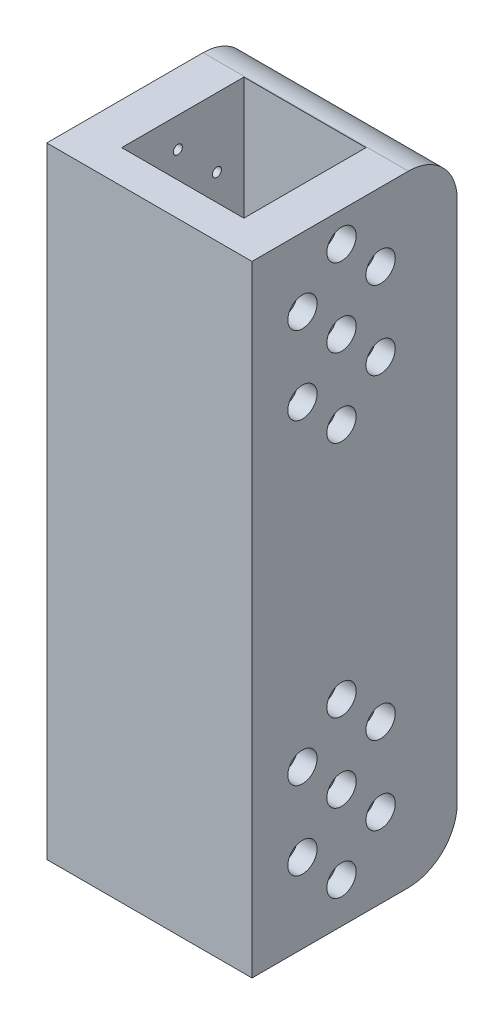
from build123d import *

# Parameters (mm, degrees)
SKETCH1_W                                           = 25
SKETCH1_H                                           = 25
BOSS_EXTRUDE1_DEPTH                                 = 127
BOSS_EXTRUDE2_DEPTH                                 = 38.819689331
FILLET1_R                                           = 10
FILLET2_R                                           = 10
CBORE_FOR_00_BINDING_HEAD_MACHINE_SCREW_D           = 1.3208
CBORE_FOR_00_BINDING_HEAD_MACHINE_SCREW_CBORE_D     = 5.999999938
CBORE_FOR_00_BINDING_HEAD_MACHINE_SCREW_CBORE_DEPTH = 3.000000096
CBORE_FOR_M5_HEX_HEAD_BOLT1_D                       = 1.85
CBORE_FOR_M5_HEX_HEAD_BOLT1_CBORE_D                 = 6
CBORE_FOR_M5_HEX_HEAD_BOLT1_CBORE_DEPTH             = 4


with BuildPart() as part:
    # Sketch1 → Boss-Extrude1 (new body)
    with BuildSketch(Plane(origin=(0, 0, 0), x_dir=(1, 0, 0), z_dir=(0, 1, 0))):
        Polygon((-34.725964288, 28.482386179), (-36.315964288, 28.482386179), (-36.315964288, -13.517613821), (5.684035712, -13.517613821), (5.684035712, 28.482386179), (4.093725043, 28.482386179), (4.093725043, 25.142386179), (-34.725964288, 25.142386179), align=None)
        with Locations((-15.315964288, 5.812386179)):
            Rectangle(SKETCH1_W, SKETCH1_H, mode=Mode.SUBTRACT)
    extrude(amount=BOSS_EXTRUDE1_DEPTH)

    # Sketch3 → Boss-Extrude2 (add)
    with BuildSketch(Plane(origin=(-34.725964288, 0, 0), x_dir=(0, 0, -1), z_dir=(1, 0, 0))):
        Polygon((28.482386179, 0.16286132), (25.142386179, 1.14), (25.142386179, 0), (28.482386179, 0), align=None)
        Polygon((28.482386179, 2.33286132), (25.142386179, 3.31), (25.142386179, 1.14), (28.482386179, 2.128184945), align=None)
        Polygon((28.482386179, 4.50286132), (25.142386179, 5.48), (25.142386179, 3.31), (28.482386179, 4.298184945), align=None)
        Polygon((28.482386179, 6.67286132), (25.142386179, 7.65), (25.142386179, 5.48), (28.482386179, 6.468184945), align=None)
        Polygon((28.482386179, 8.84286132), (25.142386179, 9.82), (25.142386179, 7.65), (28.482386179, 8.638184945), align=None)
        Polygon((28.482386179, 11.01286132), (25.142386179, 11.99), (25.142386179, 9.82), (28.482386179, 10.808184945), align=None)
        Polygon((28.482386179, 13.18286132), (25.142386179, 14.16), (25.142386179, 11.99), (28.482386179, 12.978184945), align=None)
        Polygon((28.482386179, 15.35286132), (25.142386179, 16.33), (25.142386179, 14.16), (28.482386179, 15.148184945), align=None)
        Polygon((28.482386179, 17.52286132), (25.142386179, 18.5), (25.142386179, 16.33), (28.482386179, 17.318184945), align=None)
        Polygon((28.482386179, 19.69286132), (25.142386179, 20.67), (25.142386179, 18.5), (28.482386179, 19.488184945), align=None)
        Polygon((28.482386179, 21.86286132), (25.142386179, 22.84), (25.142386179, 20.67), (28.482386179, 21.658184945), align=None)
        Polygon((28.482386179, 24.03286132), (25.142386179, 25.01), (25.142386179, 22.84), (28.482386179, 23.828184945), align=None)
        Polygon((28.482386179, 26.20286132), (25.142386179, 27.18), (25.142386179, 25.01), (28.482386179, 25.998184945), align=None)
        Polygon((28.482386179, 28.37286132), (25.142386179, 29.35), (25.142386179, 27.18), (28.482386179, 28.168184945), align=None)
        Polygon((28.482386179, 30.54286132), (25.142386179, 31.52), (25.142386179, 29.35), (28.482386179, 30.338184945), align=None)
        Polygon((28.482386179, 32.71286132), (25.142386179, 33.69), (25.142386179, 31.52), (28.482386179, 32.508184945), align=None)
        Polygon((28.482386179, 34.88286132), (25.142386179, 35.86), (25.142386179, 33.69), (28.482386179, 34.678184945), align=None)
        Polygon((28.482386179, 37.05286132), (25.142386179, 38.03), (25.142386179, 35.86), (28.482386179, 36.848184945), align=None)
        Polygon((28.482386179, 39.22286132), (25.142386179, 40.2), (25.142386179, 38.03), (28.482386179, 39.018184945), align=None)
        Polygon((28.482386179, 41.39286132), (25.142386179, 42.37), (25.142386179, 40.2), (28.482386179, 41.188184945), align=None)
        Polygon((28.482386179, 43.56286132), (25.142386179, 44.54), (25.142386179, 42.37), (28.482386179, 43.358184945), align=None)
        Polygon((28.482386179, 45.73286132), (25.142386179, 46.71), (25.142386179, 44.54), (28.482386179, 45.528184945), align=None)
        Polygon((28.482386179, 47.90286132), (25.142386179, 48.88), (25.142386179, 46.71), (28.482386179, 47.698184945), align=None)
        Polygon((28.482386179, 50.07286132), (25.142386179, 51.05), (25.142386179, 48.88), (28.482386179, 49.868184945), align=None)
        Polygon((28.482386179, 52.24286132), (25.142386179, 53.22), (25.142386179, 51.05), (28.482386179, 52.038184945), align=None)
        Polygon((28.482386179, 54.41286132), (25.142386179, 55.39), (25.142386179, 53.22), (28.482386179, 54.208184945), align=None)
        Polygon((28.482386179, 56.58286132), (25.142386179, 57.56), (25.142386179, 55.39), (28.482386179, 56.378184945), align=None)
        Polygon((28.482386179, 58.75286132), (25.142386179, 59.73), (25.142386179, 57.56), (28.482386179, 58.548184945), align=None)
        Polygon((28.482386179, 60.92286132), (25.142386179, 61.9), (25.142386179, 59.73), (28.482386179, 60.718184945), align=None)
        Polygon((28.482386179, 63.09286132), (25.142386179, 64.07), (25.142386179, 61.9), (28.482386179, 62.888184945), align=None)
        Polygon((28.482386179, 65.26286132), (25.142386179, 66.24), (25.142386179, 64.07), (28.482386179, 65.058184945), align=None)
        Polygon((28.482386179, 67.43286132), (25.142386179, 68.41), (25.142386179, 66.24), (28.482386179, 67.228184945), align=None)
        Polygon((28.482386179, 69.60286132), (25.142386179, 70.58), (25.142386179, 68.41), (28.482386179, 69.398184945), align=None)
        Polygon((28.482386179, 71.77286132), (25.142386179, 72.75), (25.142386179, 70.58), (28.482386179, 71.568184945), align=None)
        Polygon((28.482386179, 73.94286132), (25.142386179, 74.92), (25.142386179, 72.75), (28.482386179, 73.738184945), align=None)
        Polygon((28.482386179, 76.11286132), (25.142386179, 77.09), (25.142386179, 74.92), (28.482386179, 75.908184945), align=None)
        Polygon((28.482386179, 78.28286132), (25.142386179, 79.26), (25.142386179, 77.09), (28.482386179, 78.078184945), align=None)
        Polygon((28.482386179, 80.45286132), (25.142386179, 81.43), (25.142386179, 79.26), (28.482386179, 80.248184945), align=None)
        Polygon((28.482386179, 82.62286132), (25.142386179, 83.6), (25.142386179, 81.43), (28.482386179, 82.418184945), align=None)
        Polygon((28.482386179, 84.79286132), (25.142386179, 85.77), (25.142386179, 83.6), (28.482386179, 84.588184945), align=None)
        Polygon((28.482386179, 86.96286132), (25.142386179, 87.94), (25.142386179, 85.77), (28.482386179, 86.758184945), align=None)
        Polygon((28.482386179, 89.13286132), (25.142386179, 90.11), (25.142386179, 87.94), (28.482386179, 88.928184945), align=None)
        Polygon((28.482386179, 91.30286132), (25.142386179, 92.28), (25.142386179, 90.11), (28.482386179, 91.098184945), align=None)
        Polygon((28.482386179, 93.47286132), (25.142386179, 94.45), (25.142386179, 92.28), (28.482386179, 93.268184945), align=None)
        Polygon((28.482386179, 95.64286132), (25.142386179, 96.62), (25.142386179, 94.45), (28.482386179, 95.438184945), align=None)
        Polygon((28.482386179, 97.81286132), (25.142386179, 98.79), (25.142386179, 96.62), (28.482386179, 97.608184945), align=None)
        Polygon((28.482386179, 99.98286132), (25.142386179, 100.96), (25.142386179, 98.79), (28.482386179, 99.778184945), align=None)
        Polygon((28.482386179, 102.15286132), (25.142386179, 103.13), (25.142386179, 100.96), (28.482386179, 101.948184945), align=None)
        Polygon((28.482386179, 104.32286132), (25.142386179, 105.3), (25.142386179, 103.13), (28.482386179, 104.118184945), align=None)
        Polygon((28.482386179, 106.49286132), (25.142386179, 107.47), (25.142386179, 105.3), (28.482386179, 106.288184945), align=None)
        Polygon((28.482386179, 108.66286132), (25.142386179, 109.64), (25.142386179, 107.47), (28.482386179, 108.458184945), align=None)
        Polygon((28.482386179, 110.83286132), (25.142386179, 111.81), (25.142386179, 109.64), (28.482386179, 110.628184945), align=None)
        Polygon((28.482386179, 113.00286132), (25.142386179, 113.98), (25.142386179, 111.81), (28.482386179, 112.798184945), align=None)
        Polygon((28.482386179, 115.17286132), (25.142386179, 116.15), (25.142386179, 113.98), (28.482386179, 114.968184945), align=None)
        Polygon((28.482386179, 117.34286132), (25.142386179, 118.32), (25.142386179, 116.15), (28.482386179, 117.138184945), align=None)
        Polygon((28.482386179, 119.51286132), (25.142386179, 120.49), (25.142386179, 118.32), (28.482386179, 119.308184945), align=None)
        Polygon((28.482386179, 121.68286132), (25.142386179, 122.66), (25.142386179, 120.49), (28.482386179, 121.478184945), align=None)
        Polygon((28.482386179, 123.85286132), (25.142386179, 124.83), (25.142386179, 122.66), (28.482386179, 123.648184945), align=None)
        Polygon((28.482386179, 126.02286132), (25.142386179, 127), (25.142386179, 124.83), (28.482386179, 125.818184945), align=None)
    extrude(amount=BOSS_EXTRUDE2_DEPTH)

    # Fillet1
    # the kernel refuses this fillet: 10 mm, written as the material it takes off along each edge
    with BuildSketch(Plane(origin=(30.684035712, 0, -28.482386179), x_dir=(0, 1, 0), z_dir=(-1, 0, 0))) as fillet1_piece_1:
        with BuildLine():
            CenterArc((FILLET1_R, -FILLET1_R), FILLET1_R, 90, 90)
            Line((0, -FILLET1_R), (0, 0))
            Line((0, 0), (FILLET1_R, 0))
        make_face()
    extrude(amount=92, mode=Mode.SUBTRACT)

    # Fillet2
    # the kernel refuses this fillet: 10 mm, written as the material it takes off along each edge
    with BuildSketch(Plane(origin=(30.684035712, 127, -28.482386179), x_dir=(0, -1, 0), z_dir=(-1, 0, 0))) as fillet2_piece_1:
        with BuildLine():
            CenterArc((FILLET2_R, FILLET2_R), FILLET2_R, 180, 90)
            Line((0, FILLET2_R), (0, 0))
            Line((0, 0), (FILLET2_R, 0))
        make_face()
    extrude(amount=51.590310669, mode=Mode.SUBTRACT)
    with BuildSketch(Plane(origin=(-9.725964288, 127, -28.482386179), x_dir=(0, -1, 0), z_dir=(-1, 0, 0))) as fillet2_piece_2:
        with BuildLine():
            CenterArc((FILLET2_R, FILLET2_R), FILLET2_R, 180, 90)
            Line((0, FILLET2_R), (0, 0))
            Line((0, 0), (FILLET2_R, 0))
        make_face()
    extrude(amount=51.59, mode=Mode.SUBTRACT)

    # CBORE for #00 Binding Head Machine Screw2 (through all)
    with Locations(Plane.ZY.offset(36.315964288)):
        with Locations((-12.801074859, 112.916271104), (-4.803697164, 120.913648799), (3.193680531, 112.916271104), (-4.803697164, 104.918893409), (-4.803697164, 40.918893409), (-12.801074859, 32.916271104), (-12.801074859, 16.916271104), (-12.801074859, 96.916271104), (-4.803697164, 88.918893409), (3.193680531, 96.916271104), (-4.803697164, 24.918893409), (-4.803697164, 8.918893409), (3.193680531, 16.916271104), (3.193680531, 32.916271104)):
            CounterBoreHole(CBORE_FOR_00_BINDING_HEAD_MACHINE_SCREW_D / 2, CBORE_FOR_00_BINDING_HEAD_MACHINE_SCREW_CBORE_D / 2, CBORE_FOR_00_BINDING_HEAD_MACHINE_SCREW_CBORE_DEPTH)

    # CBORE for M5 Hex Head Bolt1 (through all)
    with Locations(Plane(origin=(5.684035712, 0, 0), x_dir=(0, 0, -1), z_dir=(1, 0, 0))):
        with Locations((12.801074859, 112.916271104), (4.803697164, 120.913648799), (4.803697164, 104.918893409), (-3.193680531, 112.916271104), (-3.193680531, 96.916271104), (12.801074859, 96.916271104), (4.803697164, 88.918893409), (4.803697164, 8.258493409), (-3.193680531, 16.255871104), (-3.193680531, 32.255871104), (4.803697164, 40.258493409), (12.801074859, 32.255871104), (4.803697164, 24.258493409), (12.801074859, 16.255871104)):
            CounterBoreHole(CBORE_FOR_M5_HEX_HEAD_BOLT1_D / 2, CBORE_FOR_M5_HEX_HEAD_BOLT1_CBORE_D / 2, CBORE_FOR_M5_HEX_HEAD_BOLT1_CBORE_DEPTH)


solid = part.part
